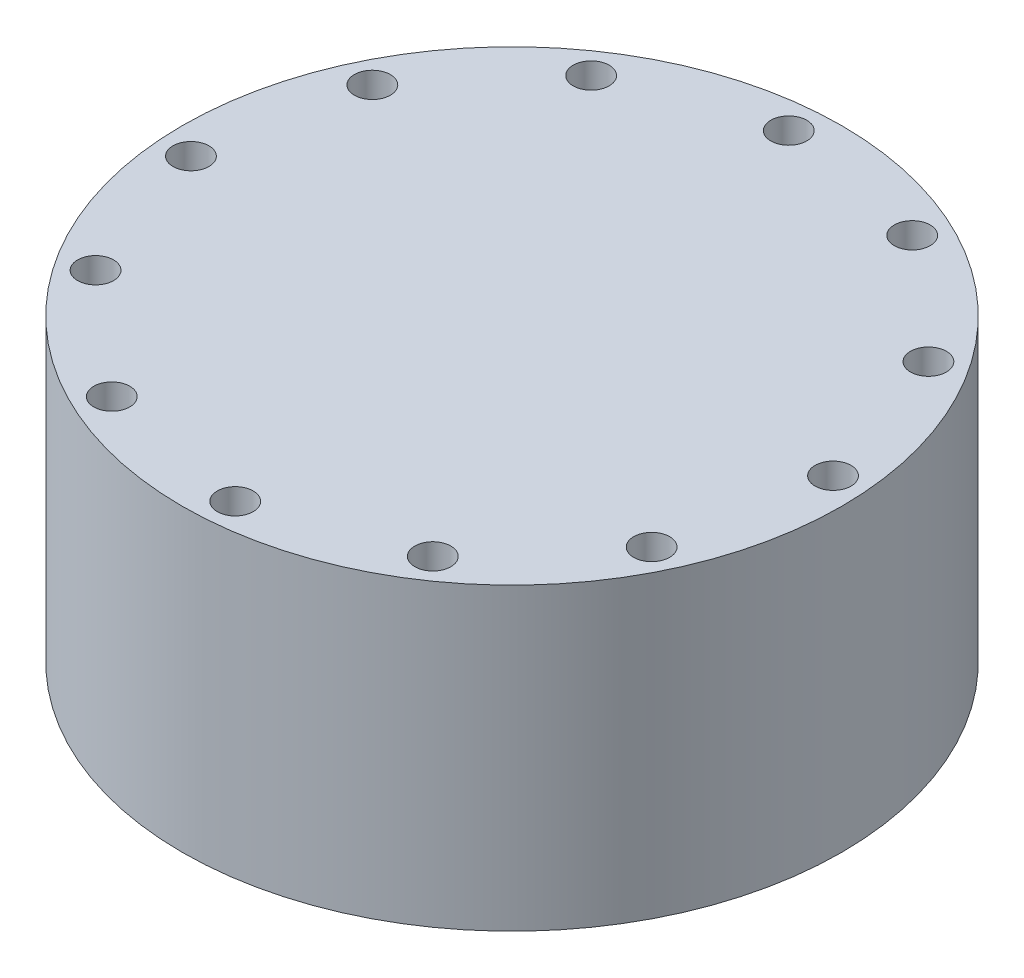
from build123d import *

# Parameters (mm, degrees)
SKETCH1_R           = 27.5
SKETCH1_R_2         = 22.5
SKETCH1_R_3         = 1.5
BOSS_EXTRUDE1_DEPTH = 25
BOSS_EXTRUDE2_START = -3
SKETCH2_R           = 22.5
BOSS_EXTRUDE2_DEPTH = 3


with BuildPart() as part:
    # Sketch1 → Boss-Extrude1 (new body)
    with BuildSketch(Plane(origin=(0, 0, 0), x_dir=(1, 0, 0), z_dir=(0, 1, 0))):
        Circle(SKETCH1_R)
        Circle(SKETCH1_R_2, mode=Mode.SUBTRACT)
        with Locations((-1.846792138, 24.931693861)):
            Circle(SKETCH1_R_3, mode=Mode.SUBTRACT)
        with Locations((10.866478024, 22.514876312)):
            Circle(SKETCH1_R_3, mode=Mode.SUBTRACT)
        with Locations((20.668084174, 14.065215838)):
            Circle(SKETCH1_R_3, mode=Mode.SUBTRACT)
        with Locations((24.931693861, 1.846792138)):
            Circle(SKETCH1_R_3, mode=Mode.SUBTRACT)
        with Locations((22.514876312, -10.866478024)):
            Circle(SKETCH1_R_3, mode=Mode.SUBTRACT)
        with Locations((14.065215838, -20.668084174)):
            Circle(SKETCH1_R_3, mode=Mode.SUBTRACT)
        with Locations((1.846792138, -24.931693861)):
            Circle(SKETCH1_R_3, mode=Mode.SUBTRACT)
        with Locations((-10.866478024, -22.514876312)):
            Circle(SKETCH1_R_3, mode=Mode.SUBTRACT)
        with Locations((-20.668084174, -14.065215838)):
            Circle(SKETCH1_R_3, mode=Mode.SUBTRACT)
        with Locations((-24.931693861, -1.846792138)):
            Circle(SKETCH1_R_3, mode=Mode.SUBTRACT)
        with Locations((-22.514876312, 10.866478024)):
            Circle(SKETCH1_R_3, mode=Mode.SUBTRACT)
        with Locations((-14.065215838, 20.668084174)):
            Circle(SKETCH1_R_3, mode=Mode.SUBTRACT)
    extrude(amount=BOSS_EXTRUDE1_DEPTH)

    # Sketch2 → Boss-Extrude2 (add)
    with BuildSketch(Plane(origin=(0, 25, 0), x_dir=(1, 0, 0), z_dir=(0, 1, 0)).offset(BOSS_EXTRUDE2_START)):
        Circle(SKETCH2_R)
    extrude(amount=BOSS_EXTRUDE2_DEPTH)


solid = part.part
